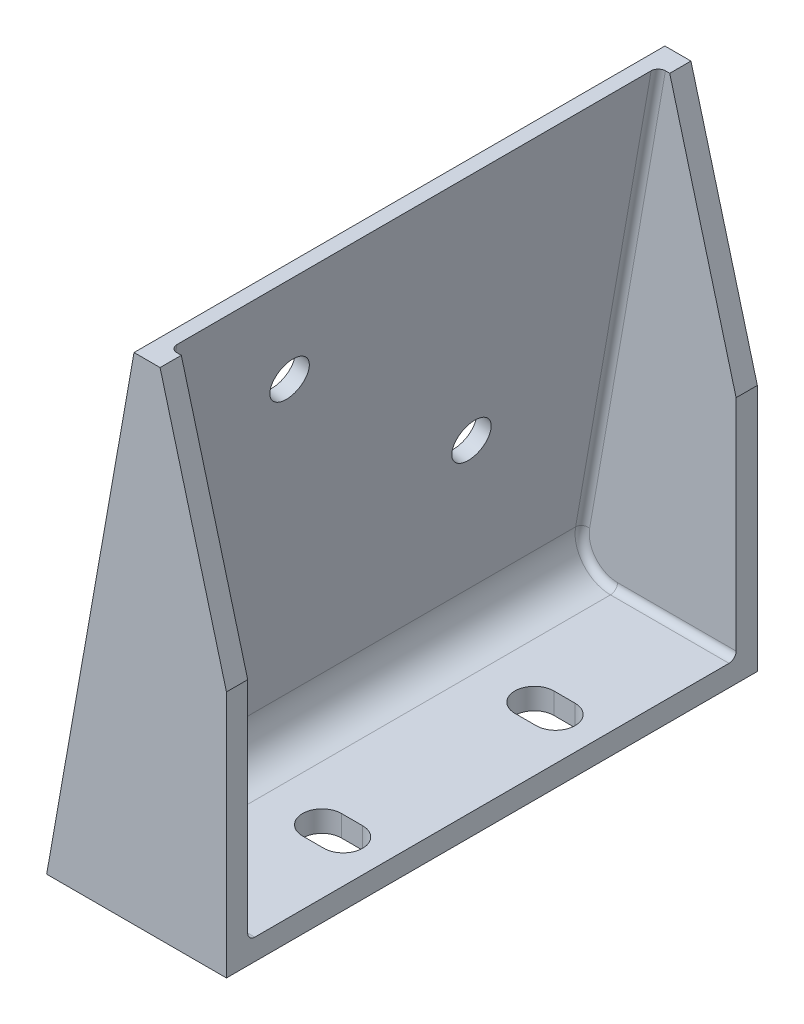
from build123d import *

# Parameters (mm, degrees)
BOSS_EXTRUDE1_DEPTH            = 37.5
SKETCH2_W                      = 11
SKETCH2_H                      = 69
CUT_EXTRUDE1_DEPTH             = 67
CUT_EXTRUDE2_REACH             = 94.575
CUT_EXTRUDE2_DIRECTION_2_REACH = 94.575
M5_CLEARANCE_SLOT1_DEPTH       = 3
M5_CLEARANCE_HOLE1_D           = 5.5
CHAMFER1_SIZE                  = 35
CHAMFER1_SIZE2                 = 9.378221735
FILLET1_R                      = 5
FILLET2_R                      = 1


# Read off the part's stored shape, not the designer's step: M5 Clearance Slot1
with BuildPart() as part:
    # Sketch1 → Boss-Extrude1 (new, symmetric)
    with BuildSketch(Plane.XY):
        Polygon((-13.05711135, 70), (-25.4, 0), (0, 0), (0, 70), align=None)
    extrude(amount=BOSS_EXTRUDE1_DEPTH, both=True)

    # Sketch2 → Cut-Extrude1 (cut)
    with BuildSketch(Plane(origin=(0, 70, 0), x_dir=(1, 0, 0), z_dir=(0, 1, 0))):
        with Locations((-5.5, 0)):
            Rectangle(SKETCH2_W, SKETCH2_H)
    extrude(amount=-CUT_EXTRUDE1_DEPTH, mode=Mode.SUBTRACT)

    # Cut-Extrude2: up to this face of the body (flat: up to its plane)
    cut_extrude2_end = Plane(part.part.faces().sort_by_distance((-5.5, 36.5, 34.5))[0])
    # Sketch6 → Cut-Extrude2 (cut, up to the picked face)
    with BuildSketch(Plane.XY.offset(17.5), mode=Mode.PRIVATE) as cut_extrude2_sk1:
        Polygon((-11, 70), (-22.697983939, 3), (-11, 3), align=None)
    cut_extrude2_tool1 = split(extrude(cut_extrude2_sk1.sketch, amount=CUT_EXTRUDE2_REACH, mode=Mode.PRIVATE), bisect_by=cut_extrude2_end, keep=Keep.BOTH, mode=Mode.PRIVATE)
    add(cut_extrude2_tool1.solids().sort_by(Axis((-14.899328, 25.333333, 17.5), (0, 0, 1)))[0], mode=Mode.SUBTRACT)

    # Cut-Extrude2 direction 2: up to this face of the body (flat: up to its plane)
    cut_extrude2_direction_2_end = Plane(part.part.faces().sort_by_distance((-5.5, 36.5, -34.5))[0])
    # Sketch6 → Cut-Extrude2 direction 2 (cut, up to the picked face)
    with BuildSketch(Plane.XY.offset(17.5), mode=Mode.PRIVATE) as cut_extrude2_direction_2_sk1:
        Polygon((-11, 70), (-22.697983939, 3), (-11, 3), align=None)
    cut_extrude2_direction_2_tool1 = split(extrude(cut_extrude2_direction_2_sk1.sketch, amount=-CUT_EXTRUDE2_DIRECTION_2_REACH, mode=Mode.PRIVATE), bisect_by=cut_extrude2_direction_2_end, keep=Keep.BOTH, mode=Mode.PRIVATE)
    add(cut_extrude2_direction_2_tool1.solids().sort_by(Axis((-14.899328, 25.333333, 17.5), (0, 0, -1)))[0], mode=Mode.SUBTRACT)

    # M5 Clearance Slot1 outline → M5 Clearance Slot1 (cut)
    with BuildSketch(Plane(origin=(0, 0, 0), x_dir=(1, 0, 0), z_dir=(0, 1, 0))):
        with BuildLine():
            Line((-9, 12.25), (-6, 12.25))
            ThreePointArc((-6, 12.25), (-3.25, 15), (-6, 17.75))
            Line((-6, 17.75), (-9, 17.75))
            ThreePointArc((-9, 17.75), (-11.75, 15), (-9, 12.25))
        make_face()
        with BuildLine():
            Line((-9, -17.75), (-6, -17.75))
            ThreePointArc((-6, -17.75), (-3.25, -15), (-6, -12.25))
            Line((-6, -12.25), (-9, -12.25))
            ThreePointArc((-9, -12.25), (-11.75, -15), (-9, -17.75))
        make_face()
    extrude(amount=M5_CLEARANCE_SLOT1_DEPTH, mode=Mode.SUBTRACT)

    # M5 Clearance Hole1 (through all)
    with Locations(Plane(origin=(-22.534821987, 3.934507249, 0), x_dir=(0, 0, -1), z_dir=(0.985097838962238, -0.17199490594761452, 0))):
        with Locations((-15, 52.064904762), (15, 27.064904762)):
            Hole(M5_CLEARANCE_HOLE1_D / 2)

    # Chamfer1
    chamfer1_edges = [part.edges().sort_by_distance(p)[0] for p in [
        (0, 70, -36),
        (0, 70, 36),
    ]]
    chamfer1_side = [part.faces().sort_by_distance(p)[0] for p in [
        (0, 1.025914226, 0),
    ]]
    chamfer(chamfer1_edges, length=CHAMFER1_SIZE, length2=CHAMFER1_SIZE2, reference=chamfer1_side[0])

    # Fillet1
    fillet1_edges = [part.edges().sort_by_distance(p)[0] for p in [
        (-22.697983939, 3, 0),
    ]]
    fillet(fillet1_edges, radius=FILLET1_R)

    # Fillet2
    fillet2_edges = [part.edges().sort_by_distance(p)[0] for p in [
        (-8.374681044, 3, -34.5),
        (-16.337425642, 39.429987265, -34.5),
        (-16.337425642, 39.429987265, 34.5),
        (-20.576885612, 4.782848515, -34.5),
        (-8.374681044, 3, 34.5),
        (-20.576885612, 4.782848515, 34.5),
    ]]
    fillet(fillet2_edges, radius=FILLET2_R)


solid = part.part
